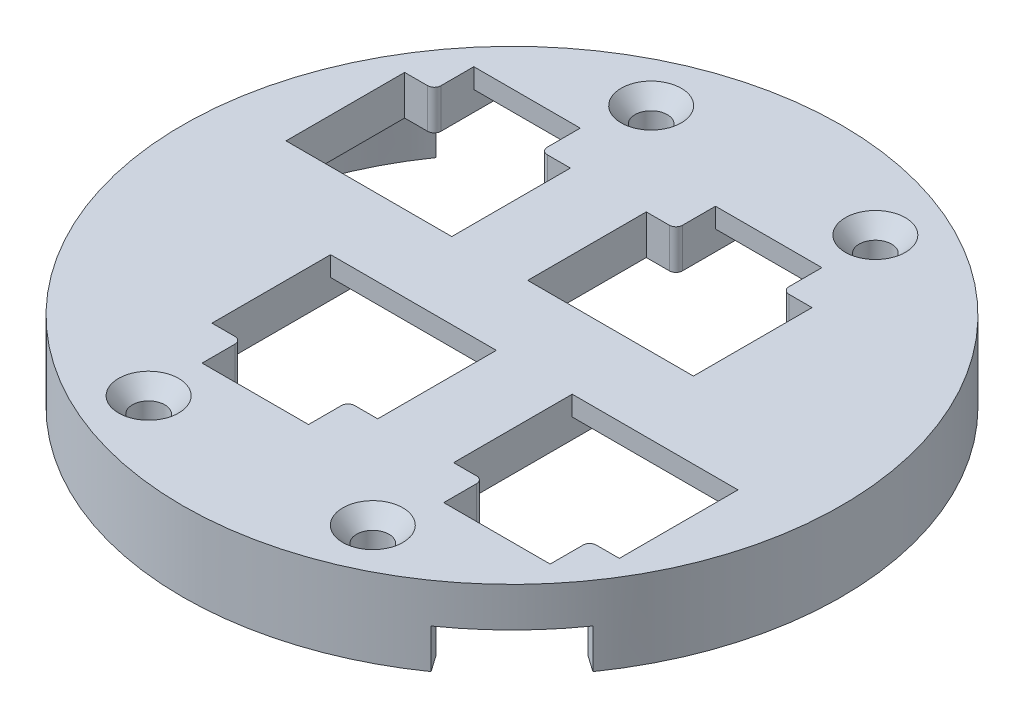
from build123d import *

# Parameters (mm, degrees)
A_BASE_T_START                                    = -1.5
A_BASE_T_OUTLINE_R                                = 47
A_BASE_T_OUTLINE_R_2                              = 1
A_BASE_T_DEPTH                                    = 3
OUTER_START                                       = -12
SKETCH2_R                                         = 50
SKETCH2_R_2                                       = 47
OUTER_RING_DEPTH                                  = 12
FINGER_BASE_THROUGH_HOLES_DEPTH                   = 72.281133549
RING_EXTRUDE_OUTLINE_R                            = 1
RING_EXTRUDE_OUTLINE_W                            = 5.516666665
RING_EXTRUDE_OUTLINE_H                            = 31.998521247
RING_EXTRUDE_OUTLINE_W_2                          = 5.516666664
RING_EXTRUDE_DEPTH                                = 3
SKETCH6_W                                         = 16.15
SKETCH6_H                                         = 4
ALLOWANCE_CUT_1_DEPTH                             = 72.281133549
ALLOWANCE_CUT_2_DEPTH                             = 6
CSK_FOR_8_FLAT_HEAD_SOCKET_CAP_SCREW1_D           = 4.9149
CSK_FOR_8_FLAT_HEAD_SOCKET_CAP_SCREW1_CSINK_D     = 9.1186
CSK_FOR_8_FLAT_HEAD_SOCKET_CAP_SCREW1_CSINK_ANGLE = 82
CLEARANCE_CONTOURING_R                            = 1


# Read off the part's stored shape, not the designer's step: a_base_t, Ring Extrude
with BuildPart() as part:
    # a_base_t outline → a_base_t (new body)
    with BuildSketch(Plane(origin=(0, 0, 0), x_dir=(1, 0, 0), z_dir=(0, 1, 0)).offset(A_BASE_T_START)):
        Circle(A_BASE_T_OUTLINE_R)
        with Locations((-17.009259258, -38.128042167)):
            Circle(A_BASE_T_OUTLINE_R_2, mode=Mode.SUBTRACT)
        with Locations((-9.166666665, -28.284271247)):
            Circle(A_BASE_T_OUTLINE_R_2, mode=Mode.SUBTRACT)
        with Locations((17.009259258, -38.128042167)):
            Circle(A_BASE_T_OUTLINE_R_2, mode=Mode.SUBTRACT)
        with Locations((27.5, -28.284271247)):
            Circle(A_BASE_T_OUTLINE_R_2, mode=Mode.SUBTRACT)
        with Locations((-27.5, 28.284271247)):
            Circle(A_BASE_T_OUTLINE_R_2, mode=Mode.SUBTRACT)
        with Locations((-17.009259258, 38.128042167)):
            Circle(A_BASE_T_OUTLINE_R_2, mode=Mode.SUBTRACT)
        with Locations((9.166666665, 28.284271247)):
            Circle(A_BASE_T_OUTLINE_R_2, mode=Mode.SUBTRACT)
        with Locations((17.009259258, 38.128042167)):
            Circle(A_BASE_T_OUTLINE_R_2, mode=Mode.SUBTRACT)
    extrude(amount=A_BASE_T_DEPTH)

    # Sketch2 → Outer Ring (add)
    with BuildSketch(Plane(origin=(0, 1.5, 0), x_dir=(1, 0, 0), z_dir=(0, 1, 0)).offset(OUTER_START)):
        with Locations(Location((0, 0, 0), (0, 0, 270))):
            Circle(SKETCH2_R)
        with Locations(Location((0, 0, 0), (0, 0, 270))):
            Circle(SKETCH2_R_2, mode=Mode.SUBTRACT)
    extrude(amount=OUTER_RING_DEPTH)

    # Sketch3 → Finger Base Through Holes (cut, through all)
    with BuildSketch(Plane.XZ.offset(1.5)):
        Polygon((35.574999997, 23.78575), (40.074999997, 23.78575), (40.074999997, 5.78575), (14.924999997, 5.78575), (14.924999997, 23.78575), (19.424999997, 23.78575), (19.424999997, 29.784271247), (35.574999997, 29.784271247), align=None)
        Polygon((-1.091666667, 29.784271247), (-17.241666667, 29.784271247), (-17.241666667, 23.78575), (-21.741666667, 23.78575), (-21.741666667, 5.78575), (3.408333333, 5.78575), (3.408333333, 23.78575), (-1.091666667, 23.78575), align=None)
        Polygon((17.241666665, -29.784271247), (1.091666665, -29.784271247), (1.091666665, -23.78575), (-3.408333335, -23.78575), (-3.408333335, -5.78575), (21.741666665, -5.78575), (21.741666665, -23.78575), (17.241666665, -23.78575), align=None)
        Polygon((-19.425, -29.784271247), (-35.575, -29.784271247), (-35.575, -23.78575), (-40.075, -23.78575), (-40.075, -5.78575), (-14.925, -5.78575), (-14.925, -23.78575), (-19.425, -23.78575), align=None)
    extrude(amount=-FINGER_BASE_THROUGH_HOLES_DEPTH, mode=Mode.SUBTRACT)

    # Ring Extrude outline → Ring Extrude (add)
    with BuildSketch(Plane.XZ.offset(1.5)):
        with BuildLine():
            Line((35.574999997, 30.715132674), (35.574999997, 23.78575))
            Line((35.574999997, 23.78575), (40.074999997, 23.78575))
            Line((40.074999997, 23.78575), (40.074999997, 1.78575))
            Line((40.074999997, 1.78575), (14.924999997, 1.78575))
            Line((14.924999997, 1.78575), (14.924999997, 23.78575))
            Line((14.924999997, 23.78575), (19.424999997, 23.78575))
            Line((19.424999997, 23.78575), (19.424999997, 33.784271247))
            Line((19.424999997, 33.784271247), (32.67450101, 33.784271247))
            ThreePointArc((32.67450101, 33.784271247), (0, 47), (-32.67450101, 33.784271247))
            Line((-32.67450101, 33.784271247), (-24.741666667, 33.784271247))
            Line((-24.741666667, 33.784271247), (-24.741666667, 1.78575))
            Line((-24.741666667, 1.78575), (-46.966063247, 1.78575))
            ThreePointArc((-46.966063247, 1.78575), (-44.354634753, -15.545622403), (-35.575, -30.715132671))
            Line((-35.575, -30.715132671), (-35.575, -23.78575))
            Line((-35.575, -23.78575), (-40.075, -23.78575))
            Line((-40.075, -23.78575), (-40.075, -1.78575))
            Line((-40.075, -1.78575), (-14.925, -1.78575))
            Line((-14.925, -1.78575), (-14.925, -23.78575))
            Line((-14.925, -23.78575), (-19.425, -23.78575))
            Line((-19.425, -23.78575), (-19.425, -33.784271247))
            Line((-19.425, -33.784271247), (-32.67450101, -33.784271247))
            ThreePointArc((-32.67450101, -33.784271247), (0, -47), (32.67450101, -33.784271247))
            Line((32.67450101, -33.784271247), (24.741666665, -33.784271247))
            Line((24.741666665, -33.784271247), (24.741666665, -1.78575))
            Line((24.741666665, -1.78575), (46.966063247, -1.78575))
            ThreePointArc((46.966063247, -1.78575), (44.354634753, 15.545622405), (35.574999997, 30.715132674))
        make_face()
        with Locations((-17.009259258, -38.128042167)):
            Circle(RING_EXTRUDE_OUTLINE_R, mode=Mode.SUBTRACT)
        with Locations((-9.166666667, -17.785010623)):
            Rectangle(RING_EXTRUDE_OUTLINE_W, RING_EXTRUDE_OUTLINE_H, mode=Mode.SUBTRACT)
        with Locations((17.009259258, -38.128042167)):
            Circle(RING_EXTRUDE_OUTLINE_R, mode=Mode.SUBTRACT)
        Polygon((17.241666665, -23.78575), (17.241666665, -33.784271247), (1.091666665, -33.784271247), (1.091666665, -23.78575), (-3.408333335, -23.78575), (-3.408333335, -1.78575), (21.741666665, -1.78575), (21.741666665, -23.78575), align=None, mode=Mode.SUBTRACT)
        Polygon((-1.091666667, 23.78575), (3.408333333, 23.78575), (3.408333333, 1.78575), (-21.741666667, 1.78575), (-21.741666667, 23.78575), (-17.241666667, 23.78575), (-17.241666667, 33.784271247), (-1.091666667, 33.784271247), align=None, mode=Mode.SUBTRACT)
        with Locations((-17.009259258, 38.128042167)):
            Circle(RING_EXTRUDE_OUTLINE_R, mode=Mode.SUBTRACT)
        with Locations((9.166666665, 17.785010623)):
            Rectangle(RING_EXTRUDE_OUTLINE_W_2, RING_EXTRUDE_OUTLINE_H, mode=Mode.SUBTRACT)
        with Locations((17.009259258, 38.128042167)):
            Circle(RING_EXTRUDE_OUTLINE_R, mode=Mode.SUBTRACT)
    extrude(amount=RING_EXTRUDE_DEPTH)

    # Sketch6 → Allowance Cut 1 (cut, through all)
    with BuildSketch(Plane.XZ.offset(1.5)):
        with Locations((27.499999997, 31.784271247)):
            Rectangle(SKETCH6_W, SKETCH6_H)
        with Locations((-27.5, -31.784271247)):
            Rectangle(SKETCH6_W, SKETCH6_H)
    extrude(amount=ALLOWANCE_CUT_1_DEPTH, mode=Mode.SUBTRACT)

    # Sketch7 → Allowance Cut 2 (cut)
    with BuildSketch(Plane.XZ.offset(10.5)):
        with BuildLine():
            Line((-38.500146082, -26.958092508), (-40.957602214, -28.678821818))
            ThreePointArc((-40.957602214, -28.678821818), (-35.355339059, -35.355339059), (-28.678821818, -40.957602214))
            Line((-28.678821818, -40.957602214), (-26.958092508, -38.500146082))
            ThreePointArc((-26.958092508, -38.500146082), (-29.909386843, -36.25504901), (-32.67450101, -33.784271247))
            Line((-32.67450101, -33.784271247), (-35.575, -33.784271247))
            Line((-35.575, -33.784271247), (-35.575, -30.715132671))
            ThreePointArc((-35.575, -30.715132671), (-37.085181063, -28.873679114), (-38.500146082, -26.958092508))
        make_face()
        with BuildLine():
            ThreePointArc((40.957602214, 28.678821818), (35.355339059, 35.355339059), (28.678821818, 40.957602214))
            Line((28.678821818, 40.957602214), (26.958092508, 38.500146082))
            ThreePointArc((26.958092508, 38.500146082), (29.909386843, 36.25504901), (32.67450101, 33.784271247))
            Line((32.67450101, 33.784271247), (35.574999997, 33.784271247))
            Line((35.574999997, 33.784271247), (35.574999997, 30.715132674))
            ThreePointArc((35.574999997, 30.715132674), (37.085181061, 28.873679115), (38.500146082, 26.958092508))
            Line((38.500146082, 26.958092508), (40.957602214, 28.678821818))
        make_face()
    extrude(amount=-ALLOWANCE_CUT_2_DEPTH, mode=Mode.SUBTRACT)

    # CSK for #8 Flat Head Socket Cap Screw1 (through all)
    with Locations(Plane(origin=(0, 1.5, 0), x_dir=(1, 0, 0), z_dir=(0, 1, 0))):
        with Locations((-17.009259258, -38.128042167), (17.009259258, -38.128042167), (17.009259258, 38.128042167), (-17.009259258, 38.128042167)):
            CounterSinkHole(CSK_FOR_8_FLAT_HEAD_SOCKET_CAP_SCREW1_D / 2, CSK_FOR_8_FLAT_HEAD_SOCKET_CAP_SCREW1_CSINK_D / 2, counter_sink_angle=CSK_FOR_8_FLAT_HEAD_SOCKET_CAP_SCREW1_CSINK_ANGLE)

    # Clearance Contouring
    clearance_contouring_edges = [part.edges().sort_by_distance(p)[0] for p in [
        (17.241666665, -1.5, -23.78575),
        (1.091666665, -1.5, -23.78575),
        (-19.425, -1.5, -23.78575),
        (-35.575, -1.5, -23.78575),
        (35.574999997, 0, 23.78575),
        (19.424999997, 0, 23.78575),
        (-1.091666667, 0, 23.78575),
        (-17.241666667, 0, 23.78575),
    ]]
    fillet(clearance_contouring_edges, radius=CLEARANCE_CONTOURING_R)


solid = part.part
